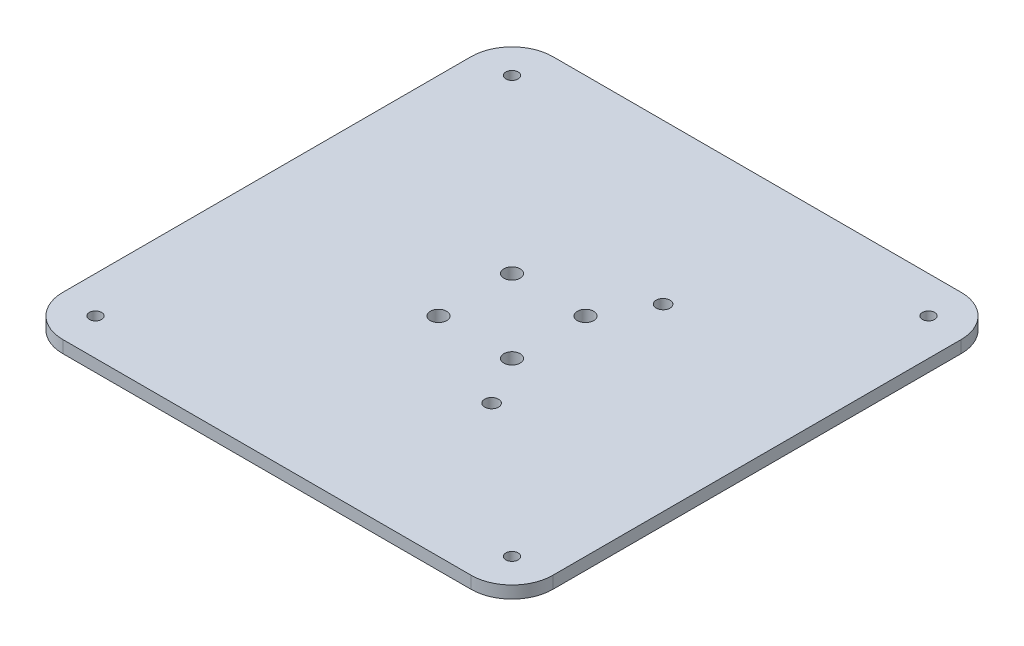
from build123d import *

# Parameters (mm, degrees)
SKETCH1_W                                  = 120
SKETCH1_H                                  = 120
SKETCH1_R                                  = 2
BOSS_EXTRUDE1_DEPTH                        = 3
FILLET1_R                                  = 10
SKETCH2_R                                  = 1.5
CUT_EXTRUDE1_DEPTH                         = 85.905830189
MIRROR3_AT_THE_SECOND_PLANE_COPY_1_SKETC_R = 1.5
MIRROR3_AT_THE_SECOND_PLANE_COPY_1_DEPTH   = 85.905830189
SKETCH3_R                                  = 1.7
CUT_EXTRUDE2_DEPTH                         = 85.905830189


with BuildPart() as part:
    # Sketch1 → Boss-Extrude1 (new body)
    with BuildSketch(Plane(origin=(0, 0, 0), x_dir=(1, 0, 0), z_dir=(0, 1, 0))):
        Rectangle(SKETCH1_W, SKETCH1_H)
        with Locations((-9, -9)):
            Circle(SKETCH1_R, mode=Mode.SUBTRACT)
        with Locations((9, 9)):
            Circle(SKETCH1_R, mode=Mode.SUBTRACT)
        with Locations((9, -9)):
            Circle(SKETCH1_R, mode=Mode.SUBTRACT)
        with Locations((-9, 9)):
            Circle(SKETCH1_R, mode=Mode.SUBTRACT)
    extrude(amount=BOSS_EXTRUDE1_DEPTH)

    # Fillet1
    fillet1_edges = [part.edges().sort_by_distance(p)[0] for p in [
        (-60, 1.5, -60),
        (60, 1.5, -60),
        (60, 1.5, 60),
        (-60, 1.5, 60),
    ]]
    fillet(fillet1_edges, radius=FILLET1_R)

    # Sketch2 → Cut-Extrude1 (cut, through all)
    with BuildSketch(Plane(origin=(0, 3, 0), x_dir=(1, 0, 0), z_dir=(0, 1, 0))):
        with Locations((-51, 51)):
            Circle(SKETCH2_R)
    cut_extrude1 = extrude(amount=-CUT_EXTRUDE1_DEPTH, mode=Mode.SUBTRACT)

    # Mirror3: Cut-Extrude1 across plane
    add(cut_extrude1.mirror(Plane.XY), mode=Mode.SUBTRACT)

    # Mirror3 at the second plane: Cut-Extrude1 across plane
    add(cut_extrude1.mirror(Plane(origin=(0, 0, 0), x_dir=(0, 0, 1), z_dir=(1, 0, 0))), mode=Mode.SUBTRACT)

    # Mirror3 at the second plane copy 1 sketc → Mirror3 at the second plane copy 1 (cut, through all)
    with BuildSketch(Plane(origin=(0, 3, 0), x_dir=(-1, 0, 0), z_dir=(0, 1, 0))):
        with Locations((-51, 51)):
            Circle(MIRROR3_AT_THE_SECOND_PLANE_COPY_1_SKETC_R)
    extrude(amount=-MIRROR3_AT_THE_SECOND_PLANE_COPY_1_DEPTH, mode=Mode.SUBTRACT)

    # Sketch3 → Cut-Extrude2 (cut, through all)
    with BuildSketch(Plane(origin=(0, 3, 0), x_dir=(1, 0, 0), z_dir=(0, 1, 0))):
        with Locations((16, 21)):
            Circle(SKETCH3_R)
        with Locations((16, -21)):
            Circle(SKETCH3_R)
    extrude(amount=-CUT_EXTRUDE2_DEPTH, mode=Mode.SUBTRACT)


solid = part.part
